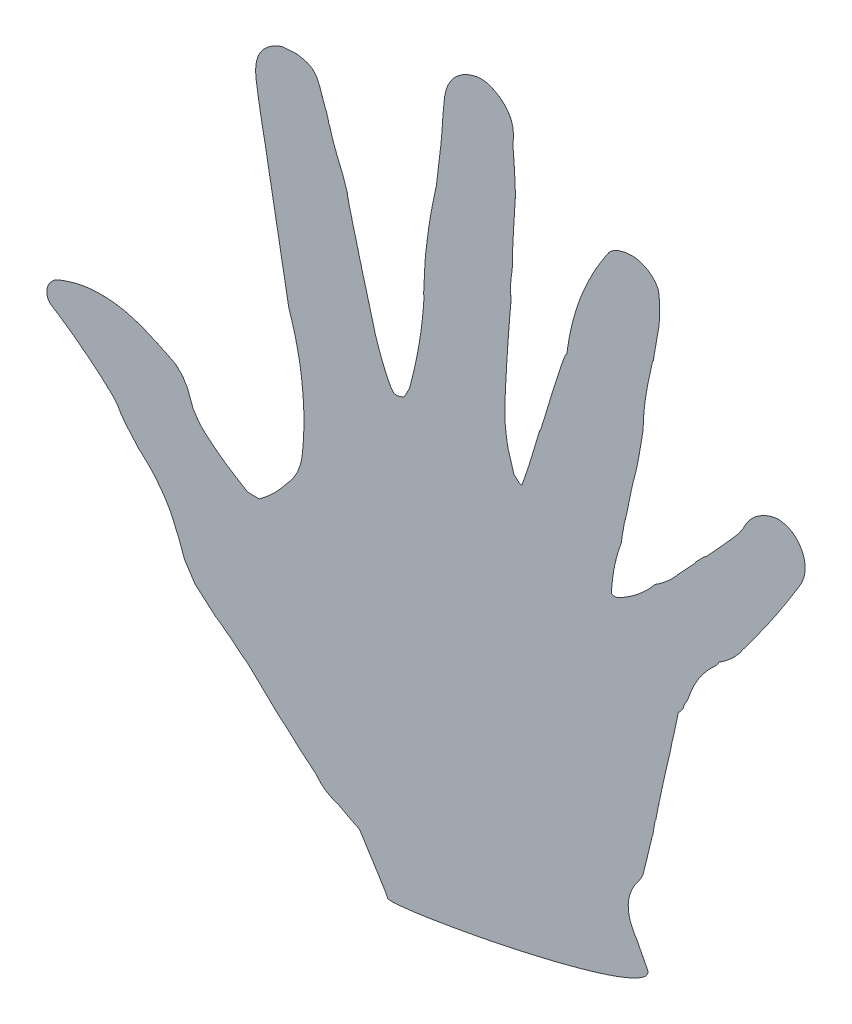
from build123d import *

# Parameters (mm, degrees)
BOSS_EXTRU_1_DEPTH = 0.00254


with BuildPart() as part:
    # Model → Boss.-Extru.1 (new body)
    with BuildSketch(Plane.XY):
        Polygon((69.799184842, -38.078468153), (69.845349121, -38.714777289), (70.463571506, -42.804277886), (71.150523546, -46.893433974), (71.906032986, -50.982762316), (72.707878961, -55.072779677), (80.471573893, -97.719788954), (81.273764377, -100.131183539), (81.983454047, -102.561353895), (82.624930827, -104.991351997), (83.197161187, -107.422039117), (83.723916287, -109.853070747), (84.159204102, -112.282896593), (84.525934516, -114.713411458), (84.800680881, -117.163391113), (85.052689616, -119.593905979), (85.212886556, -122.024076335), (85.327263726, -124.454246691), (85.350345866, -126.92386339), (85.327263726, -129.353689236), (85.212886556, -131.822789171), (85.052689616, -134.272252062), (84.800680881, -136.741351997), (84.640311686, -137.937489149), (84.388302951, -139.132592773), (84.067564562, -140.290144857), (83.632449002, -141.428748915), (83.426260037, -141.968250868), (83.174768066, -142.528423394), (82.602020942, -143.608116319), (81.960544162, -144.649913194), (81.204690213, -145.69136556), (81.159042697, -145.768535699), (81.067575412, -145.884290907), (80.976108127, -146.000046115), (80.838476562, -146.154730903), (80.540992567, -146.501996528), (80.151007758, -146.945380317), (80.082450358, -147.022205946), (79.990983073, -147.11832411), (79.922425673, -147.196183268), (79.830441623, -147.292645942), (79.784966363, -147.350179036), (79.716408963, -147.427349175), (79.670244683, -147.48522678), (79.601687283, -147.562741428), (79.532785373, -147.639911567), (79.464227973, -147.716737196), (79.441145833, -147.755666775), (79.418235948, -147.793907335), (78.525094944, -148.951114909), (77.540142144, -150.089029948), (76.555706109, -151.188704427), (75.47911377, -152.249793837), (74.402693685, -153.271953668), (73.234461806, -154.275165473), (72.066746691, -155.2394477), (70.807219781, -156.184437391), (67.096679688, -156.088319227), (65.676611328, -155.258740234), (63.982141113, -154.217287869), (62.332801649, -153.194783529), (61.09601237, -152.365549045), (59.951034885, -151.613484701), (58.897352431, -150.861420356), (58.39367947, -150.514154731), (57.912916395, -150.185492622), (57.042513021, -149.510598416), (56.263576931, -148.912874349), (55.576797146, -148.353390842), (54.980795627, -147.832492405), (53.102874078, -146.270141602), (51.843347168, -144.99683431), (50.561082628, -143.338020833), (50.561082628, -143.299780273), (50.538172743, -143.24155816), (50.492180718, -143.164388021), (50.423623318, -143.068269857), (50.355065918, -142.933222114), (50.240344238, -142.778881836), (50.125794813, -142.605249023), (49.965253364, -142.411634657), (49.393023003, -141.563452148), (47.515101454, -136.567719184), (45.81994222, -133.867108832), (43.804561361, -131.957836914), (43.621454536, -131.822789171), (43.392355686, -131.706344944), (42.911420356, -131.436938477), (42.659411621, -131.282598199), (42.361755371, -131.147205946), (41.743360731, -130.857817925), (41.102056207, -130.511241319), (40.392194282, -130.163286675), (40.025636122, -129.970705838), (39.613430447, -129.797073025), (38.765936957, -129.431548394), (37.941353353, -129.026060655), (37.140024143, -128.67879503), (36.384170193, -128.331184896), (35.651226128, -128.02284885), (33.773304579, -127.193269857), (31.895210775, -126.498738607), (30.017289225, -125.881722005), (28.138678657, -125.380460612), (27.222800022, -125.148088921), (26.283839247, -124.955508084), (24.406089952, -124.666120063), (22.527823893, -124.454246691), (20.649902344, -124.357784017), (18.817628309, -124.338491482), (16.939534505, -124.434781901), (16.023483615, -124.492659505), (15.084522841, -124.608931478), (13.206429036, -124.917439779), (11.373982747, -125.303290473), (9.496061198, -125.804551866), (7.664131673, -126.401931424), (5.786210124, -127.116444227), (5.281848145, -127.3283176), (4.801085069, -127.598757595), (4.34288737, -127.888145616), (3.907944065, -128.254014757), (3.51847602, -128.620228407), (3.152434625, -129.04535319), (2.80844184, -129.48839247), (2.487875705, -129.990342882), (2.32785102, -130.299023437), (2.19039171, -130.645600043), (2.07567003, -130.993210178), (1.98403049, -131.360112847), (1.892563205, -132.073592122), (1.892563205, -132.825656467), (1.938038466, -133.134337023), (2.00711263, -133.442673069), (2.098579915, -133.751353624), (2.19039171, -134.079326714), (2.258604601, -134.137548828), (2.30476888, -134.234011502), (2.442400445, -134.484814453), (2.648417155, -134.773857964), (2.899909125, -135.140760634), (5.533856879, -136.83781467), (8.121812609, -138.59309082), (10.664120822, -140.406589084), (13.114961751, -142.277620443), (15.565113661, -144.186892361), (17.924487305, -146.135093859), (19.115629069, -147.11832411), (20.260606554, -148.14117296), (22.527823893, -150.204785156), (23.535342068, -151.188704427), (24.016621908, -151.709602865), (24.428827582, -152.269086372), (24.864115397, -152.827880859), (25.230156793, -153.425949436), (25.596887207, -154.024362522), (25.917453342, -154.660671658), (26.215281847, -155.027574327), (26.512765842, -155.470958116), (26.879151747, -155.952926975), (27.268792046, -156.474169922), (27.749555122, -157.03296441), (28.001908366, -157.32304145), (28.253400336, -157.650325521), (28.551573351, -157.959350586), (28.825975206, -158.306271701), (29.398550076, -159.020095486), (29.69672309, -159.309483507), (29.948387316, -159.598871528), (30.20039605, -159.868967014), (30.40641276, -160.13871799), (30.635683865, -160.350935872), (30.818618435, -160.563498264), (31.11644694, -160.949004449), (31.277160645, -161.084396701), (31.39102105, -161.219099935), (31.483177355, -161.335199653), (31.5515625, -161.431662326), (31.666111925, -161.546728516), (31.689194065, -161.623898655), (32.765097385, -162.511010742), (33.750222439, -163.437396918), (34.735347493, -164.363094076), (35.651226128, -165.327720812), (36.544194878, -166.292347548), (37.391516113, -167.295559353), (38.971953668, -169.35848253), (39.727979872, -170.399934896), (40.437841797, -171.48066135), (41.125310601, -172.561387804), (41.743360731, -173.679665799), (42.361755371, -174.798632812), (42.888682726, -175.955840386), (43.873118761, -178.328133138), (44.56041531, -179.775073242), (46.5985338, -185.349582248), (50.034327528, -190.557877604), (56.859406196, -196.49860026), (57.065422906, -196.53718533), (58.920606825, -197.868025716), (60.72979872, -199.276036241), (62.538818359, -200.703683811), (64.302879503, -202.188864475), (65.081126573, -202.786933051), (67.096679688, -204.32964681), (68.012730577, -205.120640734), (76.944829644, -213.684803602), (80.128614638, -216.346828885), (83.884629991, -219.819140625), (87.937957086, -223.194300673), (89.44983724, -224.44797092), (89.770747884, -224.853114149), (90.091314019, -225.258257378), (90.43444553, -225.643763563), (90.778266059, -226.029958767), (91.190471734, -226.376879883), (91.579595269, -226.724145508), (91.808866374, -226.878830295), (91.923243544, -226.955655924), (92.014710829, -227.052118598), (92.243809679, -227.206458876), (92.358359104, -227.283973524), (92.450170898, -227.380436198), (92.953843859, -227.669479709), (93.457861328, -227.95852322), (93.984960938, -228.228963216), (94.259535048, -228.36366645), (94.511027018, -228.518351237), (95.083774143, -228.749172635), (95.381602648, -228.865272352), (95.656693522, -228.999975586), (95.976915148, -229.09643826), (96.275088162, -229.212537977), (96.893482802, -229.444048394), (97.694812012, -229.868139648), (98.473748101, -230.312212457), (100.099488661, -231.160739475), (101.748483615, -231.990662977), (102.18377143, -232.182899306), (102.595977105, -232.395461697), (103.420732964, -232.819552951), (106.832927789, -238.220429145), (107.313690864, -238.93390842), (107.749150933, -239.62843967), (108.184438748, -240.303678385), (108.573562283, -240.959624566), (108.985595703, -241.576985677), (109.352326118, -242.174709744), (109.718712023, -242.753485786), (110.039278158, -243.313313802), (110.382926432, -243.814575195), (110.680754937, -244.316181098), (111.253329807, -245.241878255), (111.528076172, -245.646676975), (111.757175022, -246.052164714), (111.986273872, -246.418722873), (112.169380697, -246.765643989), (112.375569661, -247.151150174), (112.513028971, -247.594878472), (112.558676487, -247.633463542), (112.604668511, -247.652756076), (112.627578396, -247.691341146), (112.719045681, -247.729926215), (112.833595106, -247.768511285), (113.154161241, -247.807096354), (113.360694716, -247.807096354), (113.589621311, -247.845681424), (113.864195421, -247.845681424), (114.162023926, -247.845681424), (114.482590061, -247.826388889), (114.826238336, -247.826388889), (115.215361871, -247.788148329), (115.6277398, -247.768511285), (116.06285536, -247.729926215), (116.521225315, -247.710633681), (117.50566135, -247.594878472), (118.559171549, -247.479123264), (119.131918674, -247.401953125), (119.429747179, -247.363368056), (119.704321289, -247.344075521), (120.322715929, -247.266905382), (120.918372938, -247.209372287), (122.246457248, -247.016102431), (123.620878092, -246.823177083), (124.353822157, -246.707766385), (125.086766222, -246.611303711), (126.621384006, -246.379448785), (128.407321506, -246.071457248), (130.193603516, -245.781380208), (132.003656684, -245.473044162), (132.919707574, -245.319048394), (133.378249783, -245.241878255), (133.607348633, -245.203293186), (133.812676324, -245.183311632), (135.668204753, -244.836390516), (137.500306532, -244.508761936), (139.355145942, -244.161496311), (139.606637912, -244.103963216), (139.836081272, -244.065378147), (140.294278971, -243.987863498), (141.209985352, -243.83352322), (143.11167806, -243.448017036), (144.07320421, -243.254747179), (144.324696181, -243.197214084), (144.55413954, -243.158629015), (145.01199273, -243.081458876), (146.935734049, -242.675971137), (148.859475369, -242.290464952), (150.829036458, -241.865684679), (151.332709418, -241.75027398), (151.585923937, -241.692740885), (151.814678277, -241.653811306), (152.776204427, -241.461230469), (154.745765516, -241.036794705), (156.715326606, -240.612358941), (159.005626085, -240.071823459), (161.227023655, -239.570217556), (163.380552843, -239.068956163), (165.464146593, -238.56735026), (167.502954102, -238.066088867), (169.472170681, -237.564482964), (171.39660102, -237.062877062), (173.22835829, -236.581252713), (175.037722439, -236.0793023), (176.755447049, -235.597333442), (178.427007378, -235.115364583), (180.007617187, -234.65234375), (181.564800347, -234.169685872), (183.030343967, -233.706665039), (184.450412326, -233.244333225), (185.801923286, -232.780967882), (187.359106445, -232.221484375), (188.778830295, -231.681637912), (190.084521484, -231.14144694), (191.275146484, -230.640185547), (192.374820964, -230.1189426), (193.336691623, -229.637318251), (194.206922743, -229.154660373), (194.939694553, -228.691984049), (195.603908963, -228.228963216), (196.131353082, -227.785579427), (196.543041992, -227.341851128), (196.818305122, -226.936707899), (197.024666341, -226.53156467), (197.092534722, -226.145369466), (197.047403971, -225.759518772), (196.886518012, -225.412597656), (196.704272461, -225.046384006), (196.497566732, -224.679825846), (196.268467882, -224.236097548), (196.016975911, -223.773421224), (195.764450412, -223.233230252), (195.466449653, -222.674091254), (195.146055773, -222.056385634), (194.802579753, -221.420421007), (193.565790473, -218.950976562), (192.878838433, -217.870939128), (192.558100043, -217.330403646), (192.260099284, -216.790212674), (191.756770833, -215.710519748), (191.344392904, -214.668722873), (191.184195964, -214.128531901), (191.046736654, -213.588685438), (190.817637804, -212.546888563), (190.749080404, -212.007042101), (190.702916124, -211.467195638), (190.657096354, -210.425054253), (190.749080404, -209.345016819), (190.932014974, -208.303219944), (191.207278103, -207.242819553), (191.573491753, -206.201022678), (191.802246094, -205.661176215), (192.054082574, -205.139933268), (192.604264323, -204.098136393), (193.290871853, -203.056684028), (194.023988173, -202.014887153), (194.321299913, -201.609743924), (194.573480903, -201.223893229), (194.825661892, -200.81909451), (195.032023112, -200.433588325), (195.238039822, -200.009152561), (195.397892253, -199.604353841), (195.535351562, -199.160281033), (195.626991102, -198.735845269), (195.993204753, -197.347127279), (196.337025282, -195.958064779), (196.704272461, -194.531450738), (197.024666341, -193.084510634), (197.757438151, -190.114149306), (198.123651801, -188.590039062), (198.307275391, -187.818682183), (198.398225911, -187.432831489), (198.443701172, -187.239906141), (198.466783312, -187.143443468), (198.466783312, -187.066273329), (198.627324761, -186.911933051), (199.383178711, -182.359928385), (199.5668023, -182.205243598), (199.703917101, -181.568934462), (199.818294271, -180.912988281), (199.955753581, -180.218801541), (200.092868381, -179.505322266), (200.184852431, -179.119471571), (200.230327691, -178.926201714), (200.25375434, -178.829739041), (200.25375434, -178.752913411), (200.390524631, -177.961919488), (200.57449273, -177.15163303), (200.66578776, -176.727197266), (200.71195204, -176.515668403), (200.734345161, -176.322054036), (200.84906684, -175.859722222), (200.94105089, -175.415993924), (201.123640951, -174.509244792), (201.3527398, -173.5642551), (201.53636339, -172.599628364), (201.76511773, -171.577124023), (201.83401964, -171.307717556), (201.8794949, -171.056914605), (201.97147895, -170.554619683), (202.10859375, -170.01477322), (202.17715115, -169.744677734), (202.22297092, -169.493874783), (202.45206977, -168.394544813), (204.330335829, -160.389520942), (204.925648329, -157.283767361), (204.949074978, -157.264819336), (204.949074978, -157.226578776), (204.994205729, -157.071893989), (205.040370009, -156.936501736), (205.063796658, -156.860020616), (205.063796658, -156.801798503), (205.108582899, -156.6285102), (205.13132053, -156.589580621), (205.13132053, -156.570977105), (205.13132053, -156.531703016), (205.13132053, -156.454877387), (205.200911458, -156.22371148), (205.246042209, -155.972908529), (205.337681749, -155.702124023), (205.383501519, -155.413080512), (205.475485569, -155.084762912), (205.544042969, -154.738186306), (205.635682509, -154.371628147), (205.704239909, -153.985777452), (205.887863498, -153.059735786), (206.070453559, -152.249793837), (206.230995009, -151.497384983), (206.391536458, -150.802853733), (206.505913628, -150.166889106), (206.643372938, -149.56882053), (206.735356988, -149.047577582), (206.826652018, -148.565608724), (206.895553928, -148.160465495), (207.329980469, -147.81319987), (207.697572157, -147.40840115), (208.063096788, -146.945380317), (208.384524197, -146.42413737), (208.475474718, -146.270141602), (208.521294488, -146.173678928), (208.544032118, -146.135093859), (208.544032118, -146.115456814), (208.544032118, -146.076871745), (208.613623047, -145.903927951), (208.658753798, -145.807465278), (208.681491428, -145.711002604), (208.772786458, -145.286222331), (208.933672418, -144.862131076), (209.002229818, -144.746031359), (209.048049588, -144.649913194), (209.186197917, -144.418402778), (209.277148438, -144.283355035), (209.345705838, -144.167599826), (209.506247287, -143.89784885), (209.689526367, -143.588823785), (209.781165907, -143.415535482), (209.826641168, -143.319072808), (209.849378798, -143.24155816), (209.964100477, -143.010047743), (210.055740017, -142.778881836), (210.102248806, -142.701711697), (210.124641927, -142.662782118), (210.124641927, -142.644178602), (210.170461697, -142.528423394), (210.261756727, -142.277620443), (210.651741536, -141.254771593), (210.994873047, -140.367314996), (211.338349067, -139.518443468), (212.117285156, -137.878922526), (212.987171766, -136.278675673), (213.949042426, -134.75456543), (215.048716905, -133.269384766), (216.193866645, -131.86137424), (217.476820204, -130.491948785), (218.140001085, -129.836347114), (218.805249023, -129.218641493), (219.239675564, -128.794205729), (219.583151584, -128.370114475), (219.881496853, -127.907093641), (220.132988824, -127.444072808), (221.186499023, -126.749541558), (222.171796332, -126.036062283), (223.133322483, -125.283997938), (224.026635742, -124.492659505), (224.919949002, -123.663597276), (225.721622721, -122.795433214), (226.522951931, -121.888856337), (227.255379232, -120.982107205), (227.599199761, -120.365607368), (228.79051378, -118.822032335), (229.93600803, -117.259681532), (231.12628852, -115.67752143), (232.271782769, -114.076757813), (234.608246528, -110.797715929), (235.798871528, -109.119437663), (236.943676758, -107.422039117), (238.134301758, -105.686227756), (238.730647786, -104.798771159), (238.890500217, -104.567260742), (239.027959527, -104.355559625), (239.303222656, -103.930607096), (241.638997396, -100.343229167), (242.829966905, -98.510610623), (243.974772135, -96.659044054), (246.310891385, -92.878740777), (246.928597005, -91.798186578), (247.181122504, -91.257995605), (247.386794705, -90.736924913), (247.754041884, -89.656542969), (247.959714084, -88.577022298), (248.051698134, -88.017194282), (248.097173394, -87.477692329), (248.074091254, -86.397138129), (248.051698134, -85.838171387), (247.959714084, -85.29780816), (247.685139974, -84.217770725), (247.386794705, -83.272608778), (246.952023655, -82.384979926), (246.333629015, -81.362475586), (245.555037435, -80.417830404), (245.096495226, -79.916052246), (244.570773655, -79.472840712), (244.043674045, -79.067697483), (243.448361545, -78.720087348), (242.853049045, -78.392286513), (242.188490126, -78.141483561), (241.524620226, -77.929782444), (240.791848416, -77.774925401), (239.966748047, -77.640394423), (239.141992187, -77.620585124), (238.317925347, -77.697583008), (237.447694227, -77.8903361), (236.669102648, -78.103243001), (235.890511068, -78.392286513), (235.157050239, -78.681674533), (234.424278429, -79.047888184), (233.760408529, -79.414963108), (233.096538628, -79.819589572), (232.47745497, -80.244369846), (231.859749349, -80.726683214), (231.309912109, -81.209168837), (230.76007487, -81.74832628), (230.2560574, -82.307982042), (229.77512207, -82.905533854), (229.34035102, -83.52341173), (228.904890951, -84.198650445), (228.515250651, -84.873716905), (228.126299371, -85.625953505), (227.988495551, -85.895359972), (227.80590549, -86.184920247), (227.622626411, -86.455015734), (227.39421658, -86.725283474), (227.072789171, -87.265302192), (226.683493381, -87.805493164), (226.293853082, -88.326391602), (225.859082031, -88.866410319), (223.385847982, -91.682259115), (220.866449653, -94.479159885), (218.347051324, -97.237820095), (215.804226345, -99.976154243), (215.506570095, -100.034720866), (212.438023546, -103.140129937), (212.438023546, -103.409880914), (206.849389648, -109.389877658), (206.093880208, -110.295937771), (205.246042209, -111.183394368), (204.398893229, -112.051558431), (203.460449219, -112.899913194), (202.52062717, -113.691079373), (201.53636339, -114.462780762), (200.504901801, -115.214672852), (199.405916341, -115.928841146), (198.146733941, -117.375608995), (197.505946181, -118.06996799), (196.818305122, -118.764154731), (195.420974392, -120.075874837), (193.932348633, -121.348837619), (193.199232313, -121.927613661), (192.420640734, -122.525682237), (191.642049154, -123.084821235), (190.817637804, -123.644476997), (189.146421984, -124.685584852), (188.298239475, -125.16824273), (187.404926215, -125.670193142), (186.512646484, -125.90101454), (185.503922526, -125.823499891), (185.183184136, -125.515163845), (185.343725586, -123.374209256), (185.572824436, -121.31025255), (185.870480686, -119.265243869), (186.236694336, -117.279318576), (186.695236545, -115.292015245), (187.199254015, -113.381882053), (187.794566515, -111.511711968), (188.435354275, -109.678748915), (188.527682834, -108.92668457), (188.618977865, -108.116742622), (188.756092665, -107.325748698), (188.802601454, -106.959535048), (188.848076714, -106.670147027), (188.917323134, -106.381103516), (188.962109375, -106.1297838), (189.008273655, -105.917565918), (189.054437934, -105.744277615), (189.099568685, -105.647642687), (189.099568685, -105.531715224), (189.146421984, -105.358082411), (189.146421984, -105.165329319), (189.191552734, -104.895061578), (189.237027995, -104.586725532), (189.282847765, -104.219650608), (189.329012044, -103.834144423), (189.374831814, -103.737509494), (189.397569444, -103.660683865), (189.443389214, -103.506515842), (189.535028754, -103.198007541), (189.718307834, -102.503304036), (189.901242405, -101.751584201), (190.084521484, -100.960245768), (190.153078885, -100.728907606), (190.199243164, -100.516689724), (190.291227214, -100.09259847), (190.474161784, -99.166556803), (190.588538954, -98.665467665), (190.680178494, -98.183326552), (190.863457574, -97.160477702), (191.115638563, -96.002925618), (191.321999783, -94.942008464), (191.527327474, -93.978070747), (191.710606554, -93.109906684), (191.894230143, -92.299964735), (192.054082574, -91.585624186), (192.214279514, -90.968607585), (192.328656684, -90.428588867), (192.467149523, -89.985377333), (192.535362413, -89.753005642), (192.581526693, -89.54113227), (192.718641493, -89.059163411), (192.810625543, -88.557729763), (193.084855143, -87.477692329), (193.222314453, -86.899088542), (193.290871853, -86.590063477), (193.336691623, -86.300675456), (193.428331163, -85.973046875), (193.497577582, -85.664366319), (193.634692383, -85.008592394), (193.772151693, -84.314233398), (193.909266493, -83.600237359), (194.000906033, -83.214731174), (194.046725803, -83.021978082), (194.070152452, -82.924998644), (194.070152452, -82.848517524), (194.206922743, -82.095936415), (194.344726562, -81.305459256), (194.482185872, -80.494483778), (195.512613932, -74.457642958), (195.535351562, -73.839765082), (195.535351562, -73.242385525), (195.581515842, -72.026955838), (195.626991102, -71.390474447), (195.650073242, -70.773113336), (195.741712782, -69.499806044), (195.878483073, -68.169137912), (195.970811632, -67.494243707), (196.039024523, -66.83881429), (196.222648112, -65.46887207), (196.428664822, -64.079981825), (196.474829102, -63.925641547), (196.497566732, -63.848815918), (196.497566732, -63.790938314), (196.543041992, -63.520153809), (196.634681532, -62.961187066), (196.749058702, -62.382583279), (196.840698242, -61.803807237), (197.070141602, -60.588894314), (197.207600911, -59.951379395), (197.252731662, -59.778607856), (197.276502821, -59.624439833), (197.321978082, -59.316103787), (197.413617622, -58.968493652), (197.459092882, -58.794688585), (197.482175022, -58.640692817), (197.620323351, -57.965798611), (197.711273872, -57.598723687), (197.779831272, -57.251113553), (197.917290582, -56.557099067), (198.238028971, -55.091210937), (198.558767361, -53.586565484), (198.765128581, -53.471154785), (200.66578776, -42.495252821), (200.734345161, -41.589020454), (200.780164931, -40.663151042), (200.82632921, -39.660283746), (200.82632921, -38.637434896), (200.84906684, -37.59632704), (200.82632921, -36.631700304), (200.80324707, -35.725123427), (200.734345161, -34.915525987), (200.66578776, -34.143996853), (200.57449273, -33.468758138), (200.45977105, -32.831932237), (200.32231174, -32.291741265), (199.863769531, -31.500747342), (199.383178711, -30.825508626), (198.833685981, -30.227784559), (198.284193251, -29.688110352), (197.688191732, -29.205452474), (197.092534722, -28.761724175), (196.451746962, -28.39568278), (195.810270182, -28.068054199), (195.100925022, -27.816734484), (194.413283963, -27.585913086), (193.679823134, -27.431228299), (192.947395833, -27.315128581), (192.145722114, -27.276715766), (191.367130534, -27.276715766), (190.519981554, -27.334765625), (189.672488064, -27.450004069), (188.778830295, -27.642929416), (188.115304905, -27.816734484), (187.473828125, -28.028780111), (186.855777995, -28.279927572), (186.283203125, -28.569143338), (185.756103516, -28.896944173), (185.252775065, -29.263330078), (184.794577365, -29.668128798), (184.358428277, -30.150614421), (183.007606337, -32.156693522), (181.702604167, -34.220477973), (180.465125868, -36.284434679), (179.298272027, -38.387665473), (178.220990668, -40.489690484), (177.190218099, -42.650109863), (176.228347439, -44.810012478), (175.312641059, -47.028309462), (174.51062283, -49.227830675), (173.75511339, -51.484195964), (173.09089898, -53.740905762), (172.47250434, -56.036545139), (171.94574924, -58.332012261), (171.464469401, -60.685356988), (171.075173611, -63.03818495), (170.731353082, -65.449235026), (170.48055013, -65.584971788), (170.365828451, -65.796845161), (170.227680122, -66.105181207), (170.067827691, -66.471911621), (169.884204102, -66.935276964), (169.701269531, -67.417245822), (169.495252821, -67.996194119), (169.265809462, -68.631641981), (169.013972982, -69.346499295), (168.762481011, -70.09821913), (168.487562391, -70.927453613), (168.189561632, -71.814565701), (167.869512261, -72.798657227), (167.548429362, -73.820817057), (167.181526693, -74.920147027), (166.816346571, -76.077526855), (166.403279622, -77.331369358), (165.990901693, -78.720087348), (165.532703993, -80.224560547), (165.051424154, -81.806548394), (164.525358073, -83.52341173), (163.998602973, -85.316756185), (163.402601454, -87.226889377), (162.784551324, -89.213848199), (162.120336914, -91.335337999), (161.891927083, -91.431800673), (159.784217665, -98.472542318), (159.509299045, -99.4171875), (159.234724935, -100.323764377), (158.959806315, -101.19192844), (158.685232205, -102.041316732), (158.456133355, -102.831449382), (158.181214735, -103.62227105), (157.951771376, -104.37450765), (157.837394206, -104.72160102), (157.700623915, -105.08781467), (157.494262695, -105.744277615), (157.265163845, -106.381103516), (157.081884766, -106.978655328), (156.853474935, -107.557431369), (156.669162326, -108.077468533), (156.486227756, -108.599400499), (156.326375326, -109.062076823), (156.142407227, -109.505460612), (156.073849826, -109.582630751), (155.959472656, -109.640508355), (155.798931207, -109.659973145), (155.547094727, -109.640508355), (153.554796007, -107.924161784), (151.882546658, -102.330360243), (151.700301107, -101.828409831), (151.378873698, -100.131183539), (151.103955078, -98.472542318), (150.897938368, -96.813212077), (150.714659288, -95.193155924), (150.646101888, -93.534514703), (150.623019748, -92.68547092), (150.577544488, -91.856064182), (150.599593099, -90.158665636), (150.623019748, -89.927327474), (150.623019748, -89.714937337), (150.623019748, -89.290501573), (150.646101888, -88.44214681), (150.691577148, -87.863715278), (150.714659288, -87.708858236), (150.714659288, -87.574499512), (150.714659288, -87.304059516), (150.760479058, -86.165972222), (150.805954319, -85.568075901), (150.829036458, -84.988955349), (150.875545247, -83.793162706), (150.966495768, -82.539492459), (151.013004557, -81.285649957), (151.103955078, -79.99339464), (151.150119358, -78.681674533), (151.242103407, -77.351350911), (151.332709418, -76.077526855), (151.424348958, -74.823856608), (151.470857747, -73.64701199), (151.561808268, -72.470511882), (151.630710178, -71.371698676), (151.722694227, -70.310437012), (151.768169488, -69.288104926), (151.859809028, -68.285409885), (151.929055447, -67.339903429), (152.020005968, -66.433154297), (152.066170247, -65.584971788), (152.157809787, -64.755048286), (152.203629557, -63.983691406), (152.294924588, -63.230765788), (152.341088867, -62.555527072), (152.501630317, -60.897058105), (152.546761068, -59.257709418), (152.501630317, -57.618188477), (152.364171007, -55.997443305), (152.364171007, -55.940426975), (152.386908637, -55.824499512), (152.386908637, -55.728036838), (152.386908637, -55.477233887), (152.432728407, -55.168897841), (152.455466037, -54.976144748), (152.455466037, -54.801995171), (152.501630317, -54.570484755), (152.523678928, -54.454385037), (152.523678928, -54.357922363), (152.570187717, -53.87578125), (152.616007487, -53.606030273), (152.638745117, -53.336451552), (152.684220378, -52.737866211), (152.776204427, -52.121021864), (152.845106337, -51.600467936), (152.890237088, -51.118326823), (152.936401367, -50.732303874), (152.982221137, -50.365745714), (153.004614258, -50.095305718), (153.004614258, -49.883087836), (153.004614258, -49.748212348), (153.027696398, -49.517046441), (153.027696398, -49.304656304), (153.027696398, -48.841463216), (153.027696398, -48.340029568), (153.027696398, -47.81947564), (153.074549696, -47.260508898), (153.074549696, -46.681560601), (153.096253798, -46.064027235), (153.096253798, -45.447010634), (153.142418077, -44.771599664), (153.165500217, -44.077585178), (153.210975477, -43.344468859), (153.233713108, -42.611524794), (153.280221897, -41.820186361), (153.325352648, -41.010761176), (153.371172418, -40.180493164), (153.394254557, -39.332138401), (153.532058377, -37.576345486), (153.623008898, -35.918221029), (153.715337457, -34.317112901), (153.806632487, -32.794036187), (153.921354167, -31.327459039), (153.990256076, -29.880863444), (154.012649197, -28.434095595), (153.943747287, -27.006964789), (153.829714627, -24.093792046), (153.646780056, -21.162015788), (153.440074327, -18.190965441), (153.165500217, -15.221120877), (153.325352648, -14.121790907), (153.371172418, -13.581255425), (153.371172418, -13.079477268), (153.371172418, -12.058178711), (153.256795247, -11.112672255), (153.119335937, -10.167682563), (152.867843967, -9.2995185), (152.730729167, -8.855962457), (152.546761068, -8.450474718), (152.134727648, -7.660169813), (151.676529948, -6.869003635), (151.127381727, -6.155352105), (150.508642578, -5.48011339), (149.798952908, -4.843631999), (149.042754449, -4.246252441), (148.195260959, -3.68625217), (147.279210069, -3.165353733), (146.24878201, -2.703194173), (145.60730523, -2.432409668), (144.94343533, -2.239656576), (144.27922092, -2.084799533), (143.591924371, -2.027955458), (142.904972331, -1.988509115), (142.194938151, -2.027955458), (141.484559462, -2.124418132), (140.751787652, -2.297706434), (140.065180122, -2.470650228), (139.378228082, -2.703194173), (138.714013672, -2.934015571), (138.072881402, -3.223403592), (137.476879883, -3.512619358), (136.904305013, -3.840764703), (136.355156793, -4.188030328), (135.805319553, -4.592484538), (135.324728733, -4.978335232), (134.843448893, -5.403804525), (134.384906684, -5.84632704), (133.927053494, -6.348277452), (133.537757704, -6.830246311), (133.148806424, -7.370437283), (132.781903754, -7.92992079), (132.438427734, -8.527817112), (131.980230035, -9.530684408), (131.774902344, -10.03263482), (131.591278754, -10.572309028), (131.316704644, -11.632881673), (131.087605794, -12.713608127), (130.835424805, -14.855079481), (130.629408095, -17.015154351), (130.446129015, -19.17557373), (130.285932075, -21.35511339), (130.262849935, -22.165227593), (130.193603516, -23.033391656), (130.125390625, -23.939451769), (130.033751085, -24.923371039), (129.942111545, -25.926582845), (129.828423394, -26.9875), (129.713701714, -28.106122504), (129.552471246, -29.282450358), (129.415356445, -30.555585395), (129.415356445, -30.690977648), (129.392618815, -30.845317925), (129.346454536, -31.153998481), (129.255504015, -31.751722548), (129.209339735, -32.311378309), (129.140782335, -32.850880263), (129.003323025, -33.892849392), (128.911683485, -34.818891059), (128.865863715, -35.261758084), (128.865863715, -35.358393012), (128.842437066, -35.47449273), (128.796961806, -35.706175401), (128.704977756, -36.477532281), (128.659502496, -36.844607205), (128.613682726, -37.190839301), (128.522043186, -37.96254069), (128.407321506, -38.830187988), (128.407321506, -39.062387424), (128.361846246, -39.274260796), (128.361846246, -39.352119954), (128.361846246, -39.39018826), (128.361846246, -39.40896403), (128.339453125, -39.448582628), (128.292944336, -39.602061632), (128.292944336, -39.717989095), (128.292944336, -39.756746419), (128.292944336, -39.775866699), (128.270551215, -39.814279514), (128.270551215, -39.872157118), (128.224731445, -39.930551487), (127.697631836, -42.398962402), (127.194303385, -44.887527127), (126.712679036, -47.375575087), (126.277563477, -49.883087836), (125.887923177, -52.372169325), (125.544791667, -54.87950982), (125.224225532, -57.387022569), (124.926052517, -59.913483344), (124.674905056, -62.651989746), (124.216707357, -71.969078234), (124.376732042, -72.200416395), (124.147805447, -75.672039117), (123.804157172, -79.183452691), (123.368869358, -82.712953016), (122.819032118, -86.281210666), (122.178244358, -89.849468316), (121.422390408, -93.476292589), (120.574896918, -97.102600098), (119.612681749, -100.767492676), (117.917867025, -103.892366536), (117.574735514, -104.085291884), (117.48257921, -104.123532444), (117.437276204, -104.143169488), (117.368029785, -104.181754557), (117.1394477, -104.297509766), (116.93343099, -104.37450765), (116.704159885, -104.470798069), (116.38359375, -104.567260742), (116.06285536, -104.645292155), (115.78828125, -104.683188205), (115.490108236, -104.72160102), (115.444632975, -104.702308485), (115.375731066, -104.702308485), (115.238616265, -104.702308485), (115.192451986, -104.683188205), (115.123894586, -104.683188205), (114.986435276, -104.683188205), (114.894795736, -104.645292155), (114.849320475, -104.625310601), (114.780074056, -104.625310601), (114.551147461, -104.548829481), (114.505672201, -104.490435113), (114.414032661, -104.4124037), (114.32273763, -104.316113281), (114.208015951, -104.201219347), (113.978744846, -103.892366536), (113.681260851, -103.506515842), (112.513028971, -101.442903646), (112.466864692, -101.269270833), (112.398651801, -101.114586046), (112.260847982, -100.80590549), (111.986273872, -100.189061144), (111.436436632, -98.954683431), (110.932763672, -97.701013184), (110.429090712, -96.466118707), (109.512523058, -93.958433702), (108.665029568, -91.450920953), (107.680421278, -87.78585612), (107.176576063, -85.93463406), (106.672558594, -84.062913683), (105.641958279, -80.244369846), (104.565882704, -76.347277832), (104.06169298, -74.399765354), (103.833110894, -73.454086643), (103.580929905, -72.56714681), (103.12255995, -70.81152615), (102.91654324, -69.962999132), (102.687272135, -69.172177463), (102.504337565, -68.361891005), (102.2981486, -67.61017117), (102.11521403, -66.857590061), (101.909025065, -66.163575575), (101.542294651, -64.79380561), (101.382269965, -64.138548448), (101.199335395, -63.540135362), (100.923900011, -62.344170464), (100.649325901, -61.26378852), (100.534776476, -60.743234592), (100.397317166, -60.280386013), (100.16873508, -59.412394206), (99.984939236, -58.601418728), (99.916554091, -58.235549588), (99.824914551, -57.907576497), (99.687455241, -57.309507921), (99.549823676, -56.827539062), (99.572733561, -56.229814996), (98.061542426, -51.619415961), (97.580090332, -50.462036133), (97.076417372, -49.285708279), (96.572916667, -48.032038032), (96.045989312, -46.758558485), (95.816890462, -46.103301324), (95.564709473, -45.484906684), (95.358692763, -44.887527127), (95.129938422, -44.327526855), (94.946314833, -43.768904622), (94.763380263, -43.267126465), (94.603183322, -42.766037326), (94.419559733, -42.321792263), (94.305010308, -41.859632704), (94.167895508, -41.45431722), (94.053518338, -41.067949761), (93.938796658, -40.721028646), (93.870239258, -40.373246257), (93.778255208, -40.065082465), (93.709697808, -39.775866699), (93.641140408, -39.545045302), (93.412041558, -39.505598958), (93.251500109, -38.444509549), (92.976753743, -37.403573947), (92.656187609, -36.381069607), (92.243809679, -35.378030056), (92.220899794, -35.261758084), (92.175252279, -35.12739936), (92.106350369, -34.953938802), (92.014710829, -34.760668945), (91.946325684, -34.529675293), (91.854686144, -34.278700087), (91.763046604, -33.989484321), (91.625587294, -33.68063151), (91.534120009, -33.333021376), (91.396316189, -32.966807726), (91.258856879, -32.561147732), (91.098832194, -32.137573242), (90.961200629, -31.674552409), (90.778266059, -31.19258355), (90.595159234, -30.672029622), (90.389142524, -30.131494141), (89.90769043, -29.051112196), (89.44983724, -28.068054199), (88.16722819, -26.601477051), (87.64047309, -26.292796495), (87.48062066, -26.157921007), (87.273742676, -26.042510308), (86.701512316, -25.810310872), (86.380773926, -25.675779894), (85.991478136, -25.56019694), (85.098164876, -25.328169759), (84.159204102, -25.116296387), (83.266063097, -24.942491319), (78.273086209, -25.23187934), (77.700855849, -25.443924967), (77.105026584, -25.694900174), (76.005868869, -26.215970866), (74.998350694, -26.774765354), (74.540152995, -27.064153375), (74.05938992, -27.392643229), (73.64666748, -27.70080702), (73.234461806, -28.048072645), (72.868075901, -28.39568278), (72.47912462, -28.78136122), (72.158558485, -29.14757487), (71.837820095, -29.552545844), (71.241990831, -30.382641602), (71.013408746, -30.787440321), (70.784137641, -31.230996365), (70.578120931, -31.674552409), (70.371931966, -32.156693522), (70.234472656, -32.61988661), (70.074275716, -33.121320258), (69.845349121, -34.143996853), (69.730799696, -35.204569499), (69.707545302, -35.744415961), (69.684635417, -36.322675239), (69.707545302, -36.882503255), (69.730799696, -37.480055067), align=None)
    extrude(amount=BOSS_EXTRU_1_DEPTH)


solid = part.part
